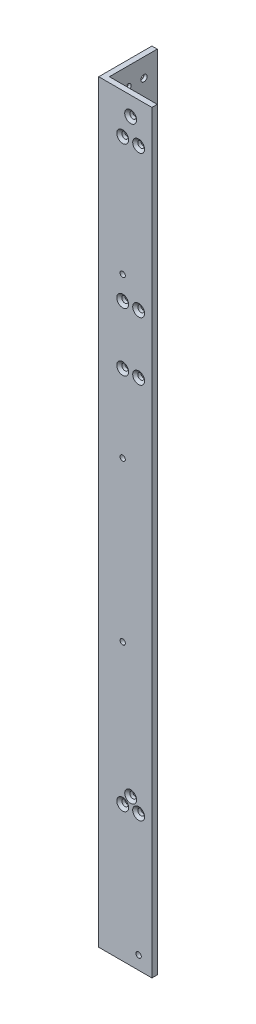
from build123d import *

# Parameters (mm, degrees)
BOSS_EXTRUDE1_DEPTH                               = 450
RIGHTSIDEHOLES_SKETCH3_R                          = 1.5875
RIGHTSIDEHOLES_CUT_EXTRUDE1_DEPTH                 = 3.175
FRONTSIDEHOLES_SKETCH4_R                          = 1.5875
FRONTSIDEHOLES_SKETCH4_R_2                        = 2
FRONTSIDEHOLES_CUT_EXTRUDE2_DEPTH                 = 3.175
CSK_FOR_6_FLAT_HEAD_MACHINE_SCREW_100_D           = 3.7973
CSK_FOR_6_FLAT_HEAD_MACHINE_SCREW_100_CSINK_D     = 7.0866
CSK_FOR_6_FLAT_HEAD_MACHINE_SCREW_100_CSINK_ANGLE = 100
CSK_FOR_6_FLAT_HEAD_MACHINE_SCREW_2_D             = 3.7973
CSK_FOR_6_FLAT_HEAD_MACHINE_SCREW_2_CSINK_D       = 7.0866
CSK_FOR_6_FLAT_HEAD_MACHINE_SCREW_2_CSINK_ANGLE   = 100


with BuildPart() as part:
    # Sketch2 → Boss-Extrude1 (new body)
    with BuildSketch(Plane(origin=(0, 0, 0), x_dir=(1, 0, 0), z_dir=(0, 1, 0))):
        Polygon((0, 31.75), (3.175, 31.75), (3.175, 3.175), (31.75, 3.175), (31.75, 0), (0, 0), align=None)
    extrude(amount=BOSS_EXTRUDE1_DEPTH)

    # RightSideHoles-Sketch3 → RightSideHoles-Cut-Extrude1 (cut)
    with BuildSketch(Plane.XY):
        with Locations((14.2875, 81.1125)):
            Circle(RIGHTSIDEHOLES_SKETCH3_R)
        with Locations((23.8125, 81.1125)):
            Circle(RIGHTSIDEHOLES_SKETCH3_R)
        with Locations((19.05, 87.4625)):
            Circle(RIGHTSIDEHOLES_SKETCH3_R)
        with Locations((14.2875, 426.1875)):
            Circle(RIGHTSIDEHOLES_SKETCH3_R)
        with Locations((19.05, 438.8875)):
            Circle(RIGHTSIDEHOLES_SKETCH3_R)
        with Locations((23.8125, 426.1875)):
            Circle(RIGHTSIDEHOLES_SKETCH3_R)
        with Locations((14.2875, 341.24737)):
            Circle(RIGHTSIDEHOLES_SKETCH3_R)
        with Locations((23.8125, 341.24737)):
            Circle(RIGHTSIDEHOLES_SKETCH3_R)
        with Locations((14.2875, 306.32237)):
            Circle(RIGHTSIDEHOLES_SKETCH3_R)
        with Locations((23.8125, 306.32237)):
            Circle(RIGHTSIDEHOLES_SKETCH3_R)
        with Locations((23.8125, 7.9375)):
            Circle(RIGHTSIDEHOLES_SKETCH3_R)
        with Locations((14.2875, 165)):
            Circle(RIGHTSIDEHOLES_SKETCH3_R)
        with Locations((14.2875, 260)):
            Circle(RIGHTSIDEHOLES_SKETCH3_R)
        with Locations((14.2875, 355)):
            Circle(RIGHTSIDEHOLES_SKETCH3_R)
    extrude(amount=-RIGHTSIDEHOLES_CUT_EXTRUDE1_DEPTH, mode=Mode.SUBTRACT)

    # FrontSideHoles-Sketch4 → FrontSideHoles-Cut-Extrude2 (cut)
    with BuildSketch(Plane.ZY):
        with Locations((-19.05, 81.1125)):
            Circle(FRONTSIDEHOLES_SKETCH4_R)
        with Locations((-23.8125, 87.4625)):
            Circle(FRONTSIDEHOLES_SKETCH4_R)
        with Locations((-14.2875, 87.4625)):
            Circle(FRONTSIDEHOLES_SKETCH4_R)
        with Locations((-23.8125, 438.8875)):
            Circle(FRONTSIDEHOLES_SKETCH4_R)
        with Locations((-14.2875, 438.8875)):
            Circle(FRONTSIDEHOLES_SKETCH4_R)
        with Locations((-19.05, 426.1875)):
            Circle(FRONTSIDEHOLES_SKETCH4_R)
        with Locations((-14.2875, 354.18487)):
            Circle(FRONTSIDEHOLES_SKETCH4_R_2)
        with Locations((-14.2875, 313.98487)):
            Circle(FRONTSIDEHOLES_SKETCH4_R_2)
        with Locations((-14.2875, 165)):
            Circle(FRONTSIDEHOLES_SKETCH4_R)
        with Locations((-14.2875, 260)):
            Circle(FRONTSIDEHOLES_SKETCH4_R)
        with Locations((-23.8125, 7.9375)):
            Circle(FRONTSIDEHOLES_SKETCH4_R)
    extrude(amount=-FRONTSIDEHOLES_CUT_EXTRUDE2_DEPTH, mode=Mode.SUBTRACT)

    # CSK for _6 Flat Head Machine Screw _100 (through all)
    with Locations(Plane.ZY):
        with Locations((-23.8125, 438.8875), (-19.05, 426.1875), (-14.2875, 438.8875), (-19.05, 81.1125), (-14.2875, 87.4625), (-23.8125, 87.4625)):
            CounterSinkHole(CSK_FOR_6_FLAT_HEAD_MACHINE_SCREW_100_D / 2, CSK_FOR_6_FLAT_HEAD_MACHINE_SCREW_100_CSINK_D / 2, counter_sink_angle=CSK_FOR_6_FLAT_HEAD_MACHINE_SCREW_100_CSINK_ANGLE)

    # CSK for _6 Flat Head Machine Screw _ 2 (through all)
    with Locations(Plane.XY):
        with Locations((14.2875, 81.1125), (19.05, 87.4625), (23.8125, 81.1125), (14.2875, 306.32237), (23.8125, 306.32237), (14.2875, 341.24737), (23.8125, 341.24737), (14.2875, 426.1875), (23.8125, 426.1875), (19.05, 438.8875)):
            CounterSinkHole(CSK_FOR_6_FLAT_HEAD_MACHINE_SCREW_2_D / 2, CSK_FOR_6_FLAT_HEAD_MACHINE_SCREW_2_CSINK_D / 2, counter_sink_angle=CSK_FOR_6_FLAT_HEAD_MACHINE_SCREW_2_CSINK_ANGLE)


solid = part.part
